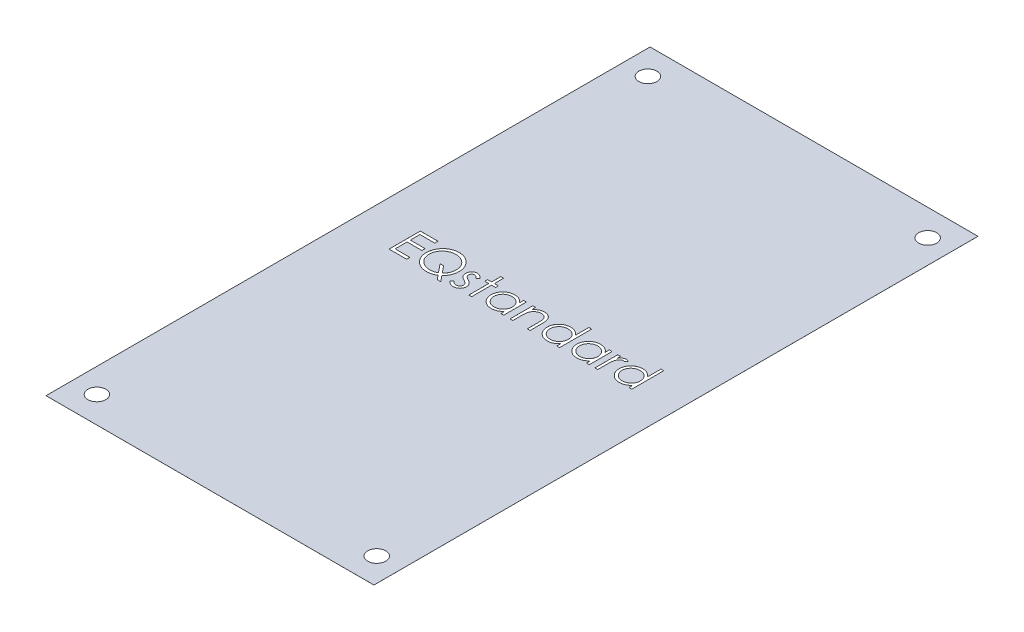
from build123d import *

# Parameters (mm, degrees)
SKETCH2_W           = 66.675
SKETCH2_H           = 122.809
BOSS_EXTRUDE1_DEPTH = 0.00254
SKETCH3_R           = 1.8288
CUT_EXTRUDE1_DEPTH  = 70.870605643
CUT_EXTRUDE2_DEPTH  = 2.54


with BuildPart() as part:
    # Sketch2 → Boss-Extrude1 (new body)
    with BuildSketch(Plane(origin=(0, 0, 0), x_dir=(1, 0, 0), z_dir=(0, 1, 0))):
        Rectangle(SKETCH2_W, SKETCH2_H)
    extrude(amount=BOSS_EXTRUDE1_DEPTH)

    # Sketch3 → Cut-Extrude1 (cut, through all)
    with BuildSketch(Plane(origin=(0, 0.00254, 0), x_dir=(1, 0, 0), z_dir=(0, 1, 0))):
        with Locations((-28.3845, 56.007)):
            Circle(SKETCH3_R)
        with Locations((28.5115, 56.007)):
            Circle(SKETCH3_R)
        with Locations((28.5115, -56.007)):
            Circle(SKETCH3_R)
        with Locations((-28.3845, -56.007)):
            Circle(SKETCH3_R)
    extrude(amount=-CUT_EXTRUDE1_DEPTH, mode=Mode.SUBTRACT)

    # Sketch5 → Cut-Extrude2 (cut)
    # profile 1 of 10: a face of its own
    with BuildSketch(Plane(origin=(0, 0.00254, 0), x_dir=(1, 0, 0), z_dir=(0, 1, 0))):
        Polygon((-24.273262233, 5.635969343), (-20.691210951, 5.635969343), (-20.691210951, 4.984687291), (-23.703390438, 4.984687291), (-23.703390438, 3.030841138), (-20.691210951, 3.030841138), (-20.691210951, 2.379559086), (-23.703390438, 2.379559086), (-23.703390438, -0.062748606), (-20.691210951, -0.062748606), (-20.691210951, -0.714030657), (-24.273262233, -0.714030657), align=None)
    # profile 2 of 10: a face of its own
    with BuildSketch(Plane(origin=(0, 0.00254, 0), x_dir=(1, 0, 0), z_dir=(0, 1, 0))):
        with BuildLine():
            Line((-14.258528659, -0.006779055), (-13.282877618, -1.202492196))
            Line((-13.282877618, -1.202492196), (-13.993945326, -1.202492196))
            Line((-13.993945326, -1.202492196), (-14.698652858, -0.340052292))
            add(Edge.make_bspline(
                [(-14.698652858, -0.340052292), (-14.769332155, -0.383003212), (-14.909388779, -0.468113862), (-15.12776825, -0.577816765), (-15.350490509, -0.669103889), (-15.57706276, -0.744523699), (-15.807154989, -0.804892833), (-16.041933971, -0.846791564), (-16.280548182, -0.871121636), (-16.440862826, -0.874934045), (-16.52147938, -0.87685117)],
                knots=[0, 0, 0, 0, 1.030216282, 2.041455142, 3.041201647, 4.026904037, 5.014869161, 6.002481075, 6.995518502, 8, 8, 8, 8], degree=3))
            add(Edge.make_bspline(
                [(-16.52147938, -0.87685117), (-16.636977427, -0.874069242), (-16.864243202, -0.868595235), (-17.198017557, -0.82080612), (-17.518390695, -0.747000035), (-17.82472404, -0.640209972), (-18.117351293, -0.503807468), (-18.3961365, -0.33564264), (-18.66122136, -0.138044763), (-18.908692816, 0.087694796), (-19.13498036, 0.333267994), (-19.3335335, 0.595651878), (-19.502357315, 0.870492505), (-19.638861426, 1.159160417), (-19.747195681, 1.459142558), (-19.821022539, 1.772933786), (-19.868809804, 2.098666145), (-19.874315014, 2.320450184), (-19.877108387, 2.432984567)],
                knots=[0, 0, 0, 0, 1.055750571, 2.07740284, 3.077223765, 4.05828044, 5.038417088, 6.02463293, 7.030503776, 8.057169806, 9.083586829, 10.080154041, 11.061747002, 12.027853603, 12.995569715, 13.972756451, 14.971366004, 16, 16, 16, 16], degree=3))
            add(Edge.make_bspline(
                [(-19.877108387, 2.432984567), (-19.876114535, 2.50851561), (-19.874133813, 2.659047027), (-19.851220923, 2.881999467), (-19.817178046, 3.101281533), (-19.769025719, 3.315981977), (-19.705990305, 3.526980825), (-19.630417352, 3.733862019), (-19.53885066, 3.93609248), (-19.435336736, 4.133258305), (-19.31988902, 4.323650647), (-19.194129201, 4.504559714), (-19.057747899, 4.674202637), (-18.910841664, 4.832501797), (-18.753997192, 4.979807117), (-18.588563219, 5.118544273), (-18.411012363, 5.243552095), (-18.22603074, 5.359804356), (-18.032580993, 5.462032121), (-17.834446997, 5.553420477), (-17.630146601, 5.627570612), (-17.422330618, 5.69075551), (-17.209738253, 5.738993574), (-16.992535192, 5.772786893), (-16.770874237, 5.79592079), (-16.621181803, 5.797827661), (-16.54564805, 5.798789856)],
                knots=[0, 0, 0, 0, 1.030721839, 2.054201982, 3.056261636, 4.058906239, 5.055198403, 6.060579377, 7.06322398, 8.083343201, 9.098870418, 10.10084648, 11.0888991, 12.067804703, 13.046436456, 14.024708667, 15.012489976, 16.008294399, 17.005242112, 17.997338632, 18.984424362, 19.969624474, 20.960977749, 21.957320355, 22.969278161, 24, 24, 24, 24], degree=3))
            add(Edge.make_bspline(
                [(-16.54564805, 5.798789856), (-16.430149572, 5.796021894), (-16.203303169, 5.79058544), (-15.870355683, 5.742789118), (-15.55092635, 5.668686864), (-15.245242567, 5.56244103), (-14.953576876, 5.425695015), (-14.676051811, 5.257564082), (-14.412237099, 5.059953116), (-14.166058761, 4.83419844), (-13.940304168, 4.588020113), (-13.742692891, 4.324205437), (-13.574563092, 4.046680224), (-13.437812881, 3.755015087), (-13.331582837, 3.449329216), (-13.257325164, 3.129498179), (-13.209757061, 2.796092484), (-13.204260667, 2.568832325), (-13.201467361, 2.453337131)],
                knots=[0, 0, 0, 0, 1.050672203, 2.063587442, 3.054842799, 4.031180399, 5.003107577, 5.981273811, 6.979214548, 7.998088659, 9.016962771, 10.014903508, 10.993069742, 11.96499692, 12.941334519, 13.932589877, 14.949327797, 16, 16, 16, 16], degree=3))
            add(Edge.make_bspline(
                [(-13.201467361, 2.453337131), (-13.204520111, 2.333163624), (-13.210523171, 2.096849226), (-13.261610242, 1.750319338), (-13.343749282, 1.419301664), (-13.460232361, 1.104013087), (-13.610818659, 0.804510916), (-13.792598959, 0.517800098), (-14.007761915, 0.243900962), (-14.174059444, 0.077660947), (-14.258528659, -0.006779055)],
                knots=[0, 0, 0, 0, 1.045660934, 2.056233022, 3.041853582, 4.009978652, 4.97562384, 5.954545411, 6.961031197, 8, 8, 8, 8], degree=3))
        make_face()
        with BuildLine():
            add(Edge.make_bspline(
                [(-14.641411271, 0.462601955), (-14.572126093, 0.532965349), (-14.435839076, 0.671373265), (-14.259009351, 0.898354923), (-14.106918048, 1.134297759), (-13.985152402, 1.382340371), (-13.888271229, 1.639375149), (-13.82133698, 1.907438739), (-13.779426832, 2.185310788), (-13.77405487, 2.374321903), (-13.771339156, 2.46987359)],
                knots=[0, 0, 0, 0, 1.052210109, 2.069743939, 3.061837814, 4.040478349, 5.010453814, 5.985306305, 6.981502329, 8, 8, 8, 8], degree=3))
            add(Edge.make_bspline(
                [(-13.771339156, 2.46987359), (-13.772048731, 2.531407689), (-13.773451437, 2.653049759), (-13.792738608, 2.833058683), (-13.820024219, 3.009091876), (-13.85952542, 3.180834814), (-13.910393262, 3.34793954), (-13.973219515, 3.510179204), (-14.046780108, 3.668077207), (-14.132535687, 3.820652692), (-14.227073957, 3.96768452), (-14.332306649, 4.10737456), (-14.446752554, 4.239002531), (-14.569161401, 4.364737602), (-14.701893234, 4.481987908), (-14.844472024, 4.59070319), (-14.995140879, 4.693514326), (-15.154645372, 4.786314648), (-15.319014704, 4.871630063), (-15.487287087, 4.945507933), (-15.65804959, 5.008079842), (-15.831037779, 5.058817624), (-16.006027805, 5.09875472), (-16.183326461, 5.1260098), (-16.362475253, 5.14527711), (-16.482843076, 5.146763606), (-16.54310398, 5.147507804)],
                knots=[0, 0, 0, 0, 1.032958288, 2.041976502, 3.037103433, 4.023477888, 4.998866292, 5.968231228, 6.943073582, 7.921783703, 8.90545537, 9.876780072, 10.85618943, 11.833110341, 12.821898168, 13.827467856, 14.842673888, 15.88323808, 16.924703457, 17.951432745, 18.967462636, 19.976958182, 20.977218729, 21.979378626, 22.98839684, 24, 24, 24, 24], degree=3))
            add(Edge.make_bspline(
                [(-16.54310398, 5.147507804), (-16.603787776, 5.146758413), (-16.724999492, 5.145261555), (-16.905013186, 5.126116364), (-17.082718743, 5.098724717), (-17.25733458, 5.058986113), (-17.429479073, 5.008149659), (-17.5986179, 4.945199469), (-17.766221979, 4.873146351), (-17.92881337, 4.787885411), (-18.086107595, 4.694287096), (-18.235704357, 4.592498238), (-18.375553538, 4.481503286), (-18.506981741, 4.36308925), (-18.629660702, 4.236342474), (-18.744169652, 4.102106074), (-18.848497612, 3.958822497), (-18.944081648, 3.809055313), (-19.028563354, 3.6526418), (-19.104755133, 3.492404032), (-19.166639782, 3.326575408), (-19.217445767, 3.156483217), (-19.258961946, 2.98255032), (-19.285720735, 2.803767043), (-19.305152581, 2.621249462), (-19.306536573, 2.497912224), (-19.307236592, 2.435528638)],
                knots=[0, 0, 0, 0, 1.013205451, 2.023808328, 3.020541854, 4.015386314, 5.012622987, 6.016502547, 7.02834558, 8.057881235, 9.080621846, 10.084476421, 11.077781791, 12.060654405, 13.037357686, 14.022218736, 15.005346502, 15.995617173, 16.98763393, 17.973029642, 18.956998942, 19.940662314, 20.93709383, 21.940823471, 22.958474994, 24, 24, 24, 24], degree=3))
            add(Edge.make_bspline(
                [(-19.307236592, 2.435528638), (-19.304853425, 2.343811213), (-19.300164998, 2.163374665), (-19.26129911, 1.89846267), (-19.196135569, 1.644850038), (-19.104969069, 1.402173945), (-18.990522034, 1.16903565), (-18.848198491, 0.947719131), (-18.678605634, 0.739067352), (-18.488159233, 0.541647159), (-18.27866535, 0.36279237), (-18.056581515, 0.205380627), (-17.823803828, 0.071830711), (-17.579601327, -0.035959654), (-17.325795039, -0.122518964), (-17.060381424, -0.181121347), (-16.7850955, -0.219964581), (-16.597513944, -0.223683436), (-16.502398852, -0.225569119)],
                knots=[0, 0, 0, 0, 1.022526523, 2.011626, 2.97850031, 3.937665323, 4.897797383, 5.869804095, 6.865337375, 7.89202157, 8.925035373, 9.93268082, 10.923937058, 11.912550332, 12.905497077, 13.90928476, 14.939882052, 16, 16, 16, 16], degree=3))
            add(Edge.make_bspline(
                [(-16.502398852, -0.225569119), (-16.437051176, -0.224857246), (-16.307798088, -0.223449212), (-16.117200107, -0.204252947), (-15.931266255, -0.177233809), (-15.751718327, -0.136140346), (-15.576999362, -0.085052132), (-15.408149342, -0.022907933), (-15.244272583, 0.050764537), (-15.140072586, 0.109048131), (-15.087895646, 0.138232965)],
                knots=[0, 0, 0, 0, 1.060694673, 2.097979151, 3.107774411, 4.11000626, 5.086069662, 6.061987343, 7.029562652, 8, 8, 8, 8], degree=3))
            Line((-15.087895646, 0.138232965), (-16.517663275, 1.891097548))
            Line((-16.517663275, 1.891097548), (-15.806595566, 1.891097548))
            Line((-15.806595566, 1.891097548), (-14.641411271, 0.462601955))
        make_face(mode=Mode.SUBTRACT)
    # profile 3 of 10: a face of its own
    with BuildSketch(Plane(origin=(0, 0.00254, 0), x_dir=(1, 0, 0), z_dir=(0, 1, 0))):
        with BuildLine():
            Line((-9.863646848, 3.347577916), (-10.250345566, 2.949430881))
            add(Edge.make_bspline(
                [(-10.250345566, 2.949430881), (-10.283711194, 2.988099018), (-10.348036197, 3.062646634), (-10.450056169, 3.162318169), (-10.551698993, 3.246023758), (-10.651573269, 3.316694285), (-10.752190414, 3.370123451), (-10.85236968, 3.409121272), (-10.952214791, 3.433254548), (-11.01895517, 3.43636503), (-11.051727778, 3.43789242)],
                knots=[0, 0, 0, 0, 1.26578478, 2.440284043, 3.530471711, 4.527705817, 5.468200915, 6.346673037, 7.188140097, 8, 8, 8, 8], degree=3))
            add(Edge.make_bspline(
                [(-11.051727778, 3.43789242), (-11.091894957, 3.435942293), (-11.17093828, 3.43210472), (-11.28419655, 3.393798925), (-11.389335541, 3.335000213), (-11.480334633, 3.251600069), (-11.557419424, 3.15587061), (-11.613687103, 3.04883442), (-11.648096816, 2.933721541), (-11.652459687, 2.853838799), (-11.654672489, 2.813323109)],
                knots=[0, 0, 0, 0, 0.99966794, 1.967205029, 2.953328237, 3.988086729, 5.028030931, 6.008226631, 6.989793394, 8, 8, 8, 8], degree=3))
            add(Edge.make_bspline(
                [(-11.654672489, 2.813323109), (-11.652657159, 2.776652686), (-11.648632178, 2.703415213), (-11.617341774, 2.595378066), (-11.567510472, 2.490046011), (-11.520937405, 2.425524738), (-11.496940118, 2.392279439)],
                knots=[0, 0, 0, 0, 0.960159726, 1.917612774, 2.927026955, 4, 4, 4, 4], degree=3))
            add(Edge.make_bspline(
                [(-11.496940118, 2.392279439), (-11.482492065, 2.374527407), (-11.451741205, 2.336744445), (-11.39403147, 2.284304597), (-11.328676358, 2.226352228), (-11.250081614, 2.16840968), (-11.161633321, 2.107392122), (-11.061413476, 2.045702538), (-10.952602589, 1.97863851), (-10.874702047, 1.936103605), (-10.834209749, 1.913994182)],
                knots=[0, 0, 0, 0, 0.66740084, 1.420478572, 2.27185888, 3.217733974, 4.268547843, 5.408967954, 6.65319498, 8, 8, 8, 8], degree=3))
            add(Edge.make_bspline(
                [(-10.834209749, 1.913994182), (-10.784836545, 1.886335573), (-10.689463772, 1.832908247), (-10.553949751, 1.749977785), (-10.430964691, 1.667552201), (-10.319466552, 1.586513004), (-10.221600698, 1.504592801), (-10.134397867, 1.424931585), (-10.060033119, 1.345122412), (-10.018388138, 1.289363763), (-9.998482586, 1.262712131)],
                knots=[0, 0, 0, 0, 1.27191281, 2.456916733, 3.569705269, 4.599008579, 5.553216877, 6.436649441, 7.252746552, 8, 8, 8, 8], degree=3))
            add(Edge.make_bspline(
                [(-9.998482586, 1.262712131), (-9.965443486, 1.208889371), (-9.899689545, 1.10177209), (-9.830640976, 0.925390086), (-9.790617335, 0.738318175), (-9.785061592, 0.610352575), (-9.782236592, 0.545284247)],
                knots=[0, 0, 0, 0, 0.995354457, 1.980940102, 2.973342416, 4, 4, 4, 4], degree=3))
            add(Edge.make_bspline(
                [(-9.782236592, 0.545284247), (-9.783542032, 0.499438796), (-9.786114544, 0.409095326), (-9.803999894, 0.276044992), (-9.834761065, 0.148800866), (-9.876659733, 0.025982278), (-9.933237095, -0.090057512), (-9.999545242, -0.202246135), (-10.079146867, -0.308156753), (-10.170026934, -0.407650295), (-10.269532331, -0.498520151), (-10.375679182, -0.578392181), (-10.488598203, -0.644748479), (-10.607482543, -0.699658462), (-10.732602315, -0.743325159), (-10.863977083, -0.773555751), (-11.001189252, -0.791649189), (-11.094497618, -0.794161025), (-11.142042281, -0.795440914)],
                knots=[0, 0, 0, 0, 1.032770009, 2.035186124, 3.017557409, 3.978232242, 4.952395191, 5.920591857, 6.910227898, 7.931268572, 8.952309245, 9.941945286, 10.918353717, 11.897095711, 12.887975737, 13.898235213, 14.929059601, 16, 16, 16, 16], degree=3))
            add(Edge.make_bspline(
                [(-11.142042281, -0.795440914), (-11.206208442, -0.793639872), (-11.333649181, -0.790062813), (-11.522134814, -0.756487531), (-11.706322477, -0.704244459), (-11.884818328, -0.632188407), (-12.053630563, -0.541200685), (-12.208082384, -0.432230342), (-12.348710323, -0.308877061), (-12.428753477, -0.214329352), (-12.468775053, -0.167055497)],
                knots=[0, 0, 0, 0, 1.013940152, 2.01379169, 3.017749504, 4.037548394, 5.051665909, 6.043208538, 7.021604269, 8, 8, 8, 8], degree=3))
            Line((-12.468775053, -0.167055497), (-12.090980582, 0.26289242))
            add(Edge.make_bspline(
                [(-12.090980582, 0.26289242), (-12.055107776, 0.224148775), (-11.985562917, 0.149038363), (-11.874344995, 0.049027059), (-11.761170938, -0.034795247), (-11.647170864, -0.104905442), (-11.530657265, -0.158926531), (-11.412283079, -0.196878837), (-11.292289081, -0.221270443), (-11.211694634, -0.224133898), (-11.171299092, -0.225569119)],
                knots=[0, 0, 0, 0, 1.179806542, 2.287233372, 3.337373186, 4.324005949, 5.273901747, 6.200048787, 7.097828587, 8, 8, 8, 8], degree=3))
            add(Edge.make_bspline(
                [(-11.171299092, -0.225569119), (-11.116293712, -0.223082051), (-11.008822427, -0.218222737), (-10.854891607, -0.174104585), (-10.712762957, -0.104925958), (-10.589349173, -0.006800862), (-10.484298109, 0.107418534), (-10.408228421, 0.236077007), (-10.360555931, 0.37539865), (-10.354957048, 0.471977256), (-10.352108387, 0.521115577)],
                knots=[0, 0, 0, 0, 1.072336372, 2.095165389, 3.102688358, 4.141489647, 5.156069229, 6.117746104, 7.042326257, 8, 8, 8, 8], degree=3))
            add(Edge.make_bspline(
                [(-10.352108387, 0.521115577), (-10.354079235, 0.561591599), (-10.357970411, 0.641506087), (-10.388528919, 0.75716742), (-10.436812237, 0.866875972), (-10.484354956, 0.931082904), (-10.508568723, 0.963783846)],
                knots=[0, 0, 0, 0, 1.013901739, 2.00181326, 2.98231254, 4, 4, 4, 4], degree=3))
            add(Edge.make_bspline(
                [(-10.508568723, 0.963783846), (-10.523123639, 0.980176574), (-10.554829502, 1.015885857), (-10.612986868, 1.067457072), (-10.682622532, 1.123043338), (-10.764519685, 1.181702078), (-10.858843423, 1.242659547), (-10.965976043, 1.305595943), (-11.084449903, 1.373500532), (-11.168216619, 1.418530478), (-11.21200422, 1.442069102)],
                knots=[0, 0, 0, 0, 0.615000592, 1.339693406, 2.178160186, 3.116406724, 4.166410947, 5.330106347, 6.604359322, 8, 8, 8, 8], degree=3))
            add(Edge.make_bspline(
                [(-11.21200422, 1.442069102), (-11.259260267, 1.468447241), (-11.350904823, 1.519602871), (-11.480712051, 1.599279188), (-11.597819394, 1.680318386), (-11.705044722, 1.758174537), (-11.799679689, 1.836952536), (-11.881351481, 1.916739835), (-11.953275601, 1.994318667), (-11.993094477, 2.049286619), (-12.012114396, 2.07554266)],
                knots=[0, 0, 0, 0, 1.262093308, 2.447601706, 3.550203992, 4.582594899, 5.537233252, 6.418365656, 7.244515135, 8, 8, 8, 8], degree=3))
            add(Edge.make_bspline(
                [(-12.012114396, 2.07554266), (-12.045008484, 2.128421133), (-12.110808155, 2.234196558), (-12.174698574, 2.410745566), (-12.218615226, 2.59661017), (-12.22253842, 2.72485632), (-12.224544284, 2.790426474)],
                knots=[0, 0, 0, 0, 0.985009483, 1.970363186, 2.962279964, 4, 4, 4, 4], degree=3))
            add(Edge.make_bspline(
                [(-12.224544284, 2.790426474), (-12.223575101, 2.833289696), (-12.221678273, 2.917179094), (-12.206539779, 3.040439525), (-12.178977675, 3.157548319), (-12.144406601, 3.270264199), (-12.096358864, 3.376403712), (-12.038944151, 3.477382267), (-11.971475537, 3.57306029), (-11.893745566, 3.661965972), (-11.808280653, 3.742718607), (-11.715942999, 3.813110403), (-11.618809305, 3.87317479), (-11.516468315, 3.923548724), (-11.407936886, 3.961651233), (-11.293973642, 3.98788106), (-11.174809261, 4.005398356), (-11.09334579, 4.006964238), (-11.051727778, 4.007764215)],
                knots=[0, 0, 0, 0, 1.087655834, 2.128696564, 3.144119009, 4.137814668, 5.115653402, 6.093965665, 7.082169637, 8.081268856, 9.086088321, 10.061021666, 11.022561449, 11.980240094, 12.950172527, 13.934149372, 14.944599409, 16, 16, 16, 16], degree=3))
            add(Edge.make_bspline(
                [(-11.051727778, 4.007764215), (-11.002393606, 4.005760625), (-10.902799803, 4.001715861), (-10.753384982, 3.969592679), (-10.604190204, 3.916736905), (-10.454832126, 3.843736881), (-10.306404887, 3.749272692), (-10.157602875, 3.635100963), (-10.006639735, 3.501972824), (-9.912376138, 3.400192801), (-9.863646848, 3.347577916)],
                knots=[0, 0, 0, 0, 0.845714091, 1.707292901, 2.609013841, 3.555613372, 4.552488639, 5.621697636, 6.770543573, 8, 8, 8, 8], degree=3))
        make_face()
    # profile 4 of 10: a face of its own
    with BuildSketch(Plane(origin=(0, 0.00254, 0), x_dir=(1, 0, 0), z_dir=(0, 1, 0))):
        Polygon((-8.072621207, 5.798789856), (-7.502749412, 5.798789856), (-7.502749412, 3.926353958), (-6.688646848, 3.926353958), (-6.688646848, 3.356482163), (-7.502749412, 3.356482163), (-7.502749412, -0.714030657), (-8.072621207, -0.714030657), (-8.072621207, 3.356482163), (-8.886723771, 3.356482163), (-8.886723771, 3.926353958), (-8.072621207, 3.926353958), align=None)
    # profile 5 of 10: a face of its own
    with BuildSketch(Plane(origin=(0, 0.00254, 0), x_dir=(1, 0, 0), z_dir=(0, 1, 0))):
        with BuildLine():
            Line((-0.9899289, 3.926353958), (-0.9899289, -0.714030657))
            Line((-0.9899289, -0.714030657), (-1.559800695, -0.714030657))
            Line((-1.559800695, -0.714030657), (-1.559800695, 0.08862359))
            add(Edge.make_bspline(
                [(-1.559800695, 0.08862359), (-1.6240605, 0.015980326), (-1.74946432, -0.125783916), (-1.958907491, -0.310990143), (-2.180918328, -0.464076526), (-2.414419296, -0.587719945), (-2.659199538, -0.680596961), (-2.914716439, -0.74661185), (-3.18107423, -0.789054951), (-3.362960645, -0.793293162), (-3.455133227, -0.795440914)],
                knots=[0, 0, 0, 0, 1.074387032, 2.096679803, 3.090159297, 4.057316773, 5.018401886, 5.985159533, 6.978961417, 8, 8, 8, 8], degree=3))
            add(Edge.make_bspline(
                [(-3.455133227, -0.795440914), (-3.5370808, -0.793215924), (-3.698685043, -0.788828146), (-3.936409226, -0.754787966), (-4.165176593, -0.70012241), (-4.385203317, -0.624102225), (-4.595065638, -0.523262734), (-4.796560385, -0.402537898), (-4.988643698, -0.258772392), (-5.168387776, -0.094419827), (-5.333908691, 0.084096793), (-5.479162714, 0.274497999), (-5.600271873, 0.475960465), (-5.701545448, 0.685933473), (-5.779553102, 0.906033398), (-5.833933838, 1.135499117), (-5.867934363, 1.374059316), (-5.872320327, 1.536509594), (-5.874544284, 1.618882003)],
                knots=[0, 0, 0, 0, 1.033919861, 2.038935746, 3.024066025, 3.998881131, 4.97069526, 5.957263378, 6.95902576, 7.993208707, 9.027059324, 10.027763471, 11.009749337, 11.988697705, 12.965288445, 13.950418724, 14.960734635, 16, 16, 16, 16], degree=3))
            add(Edge.make_bspline(
                [(-5.874544284, 1.618882003), (-5.872271036, 1.699551865), (-5.867776947, 1.859031831), (-5.834297534, 2.093580326), (-5.777998419, 2.319492027), (-5.698990181, 2.536039624), (-5.597676919, 2.743485144), (-5.474435962, 2.941975304), (-5.329258407, 3.132056925), (-5.161886183, 3.309260436), (-4.980575957, 3.472946408), (-4.786612973, 3.615202819), (-4.584822163, 3.73806053), (-4.372073558, 3.835403266), (-4.151516097, 3.914159784), (-3.921186274, 3.968648169), (-3.68204241, 4.000756166), (-3.519681088, 4.005405753), (-3.437324733, 4.007764215)],
                knots=[0, 0, 0, 0, 1.020392517, 2.01726096, 2.990465484, 3.961182959, 4.928053699, 5.906110375, 6.912531644, 7.948652711, 8.985773172, 9.998621852, 10.987621588, 11.969261332, 12.953316658, 13.946091881, 14.958173133, 16, 16, 16, 16], degree=3))
            add(Edge.make_bspline(
                [(-3.437324733, 4.007764215), (-3.342619274, 4.005155722), (-3.15690634, 4.000040593), (-2.885256952, 3.957472502), (-2.628273399, 3.885556997), (-2.383971932, 3.78773525), (-2.15322983, 3.657743985), (-1.938231558, 3.493768913), (-1.736727038, 3.296844188), (-1.619922795, 3.145586381), (-1.559800695, 3.06773016)],
                knots=[0, 0, 0, 0, 1.038897134, 2.037228247, 3.008116434, 3.962042015, 4.918381754, 5.904844433, 6.921570401, 8, 8, 8, 8], degree=3))
            Line((-1.559800695, 3.06773016), (-1.559800695, 3.926353958))
            Line((-1.559800695, 3.926353958), (-0.9899289, 3.926353958))
        make_face()
        with BuildLine():
            add(Edge.make_bspline(
                [(-3.429692521, 3.43789242), (-3.512994249, 3.434928534), (-3.677418609, 3.429078295), (-3.918798441, 3.383406383), (-4.149781349, 3.307415761), (-4.369212084, 3.203490026), (-4.57362442, 3.072809319), (-4.756311509, 2.914746237), (-4.918767552, 2.733613369), (-5.05539826, 2.530228112), (-5.166778162, 2.312190718), (-5.245095491, 2.084272094), (-5.29674684, 1.850583064), (-5.302023727, 1.692082191), (-5.304672489, 1.612521827)],
                knots=[0, 0, 0, 0, 1.031046209, 2.035121221, 3.029706178, 4.034933723, 5.034054252, 6.02443088, 7.017295772, 8.038157696, 9.050218397, 10.03989886, 11.016116709, 12, 12, 12, 12], degree=3))
            add(Edge.make_bspline(
                [(-5.304672489, 1.612521827), (-5.30128904, 1.533436918), (-5.294535404, 1.375577087), (-5.246002001, 1.141569469), (-5.164577088, 0.913597135), (-5.053466488, 0.693595047), (-4.91433504, 0.489335322), (-4.753065628, 0.304749671), (-4.568098689, 0.146018561), (-4.363215926, 0.013144677), (-4.144398608, -0.094193039), (-3.914285618, -0.168879271), (-3.677202675, -0.217098958), (-3.515999155, -0.222731366), (-3.434780662, -0.225569119)],
                knots=[0, 0, 0, 0, 0.979072187, 1.954306742, 2.945804271, 3.96968567, 4.997920485, 5.998718438, 6.996577872, 8.005894225, 9.015743152, 10.005417472, 10.995077863, 12, 12, 12, 12], degree=3))
            add(Edge.make_bspline(
                [(-3.434780662, -0.225569119), (-3.352327722, -0.22255747), (-3.188337, -0.216567599), (-2.946241059, -0.170700161), (-2.711300198, -0.094919627), (-2.486714798, 0.010125932), (-2.277498389, 0.140314278), (-2.089723668, 0.292727143), (-1.930944697, 0.469988634), (-1.796338105, 0.664800199), (-1.690791277, 0.878363392), (-1.613908999, 1.105755424), (-1.568454055, 1.34698421), (-1.562725031, 1.511837335), (-1.559800695, 1.595985368)],
                knots=[0, 0, 0, 0, 1.01762866, 2.023962475, 3.030623092, 4.058876274, 5.077231937, 6.066672613, 7.034107872, 8.005628644, 8.981990164, 9.965428785, 10.961468474, 12, 12, 12, 12], degree=3))
            add(Edge.make_bspline(
                [(-1.559800695, 1.595985368), (-1.561541785, 1.660098289), (-1.564968803, 1.786292807), (-1.591149979, 1.971581303), (-1.632796774, 2.148898206), (-1.691481969, 2.318429942), (-1.768573299, 2.479239184), (-1.861551388, 2.632480578), (-1.972051276, 2.777357118), (-2.098294167, 2.911873833), (-2.236479606, 3.034567557), (-2.38270113, 3.144085537), (-2.538691142, 3.234053739), (-2.701826338, 3.308514331), (-2.872389759, 3.367767361), (-3.051769312, 3.407296462), (-3.238058331, 3.434438759), (-3.365141889, 3.436729078), (-3.429692521, 3.43789242)],
                knots=[0, 0, 0, 0, 1.050140795, 2.067009409, 3.05949893, 4.030605086, 5.00011959, 5.97591094, 6.962425594, 7.979863591, 8.993523472, 9.986985069, 10.967611495, 11.937549037, 12.921786183, 13.919465291, 14.943216303, 16, 16, 16, 16], degree=3))
        make_face(mode=Mode.SUBTRACT)
    # profile 6 of 10: a face of its own
    with BuildSketch(Plane(origin=(0, 0.00254, 0), x_dir=(1, 0, 0), z_dir=(0, 1, 0))):
        with BuildLine():
            Line((0.312635203, 3.926353958), (0.882506998, 3.926353958))
            Line((0.882506998, 3.926353958), (0.882506998, 3.089354759))
            add(Edge.make_bspline(
                [(0.882506998, 3.089354759), (0.94335385, 3.165269414), (1.06142929, 3.312584449), (1.258069437, 3.506206063), (1.465884799, 3.665763828), (1.68360272, 3.79295214), (1.911518753, 3.888831019), (2.148243614, 3.958074922), (2.395194581, 3.99959454), (2.563132916, 4.005019672), (2.648091934, 4.007764215)],
                knots=[0, 0, 0, 0, 1.12780773, 2.188550248, 3.19190651, 4.159438251, 5.104880172, 6.052711206, 7.014878035, 8, 8, 8, 8], degree=3))
            add(Edge.make_bspline(
                [(2.648091934, 4.007764215), (2.733963227, 4.004597931), (2.902034061, 3.998400751), (3.146741401, 3.949384755), (3.37529313, 3.865664078), (3.586874324, 3.750979321), (3.777605125, 3.60836472), (3.945108784, 3.442216458), (4.083653533, 3.251106707), (4.176540178, 3.073808981), (4.237728138, 2.91653074), (4.276249665, 2.781825922), (4.308963017, 2.631751562), (4.337323474, 2.466761165), (4.356513377, 2.285698734), (4.371648677, 2.089306493), (4.382495737, 1.877648056), (4.382926098, 1.73125946), (4.383148023, 1.655771025)],
                knots=[0, 0, 0, 0, 1.235846778, 2.418850247, 3.575807741, 4.728682307, 5.871620074, 6.994088408, 8.11269785, 9.256955736, 9.865816715, 10.540099792, 11.271859618, 12.076849838, 12.949306005, 13.892391288, 14.913166135, 16, 16, 16, 16], degree=3))
            Line((4.383148023, 1.655771025), (4.383148023, -0.714030657))
            Line((4.383148023, -0.714030657), (3.813276229, -0.714030657))
            Line((3.813276229, -0.714030657), (3.813276229, 1.468781843))
            add(Edge.make_bspline(
                [(3.813276229, 1.468781843), (3.812925694, 1.531959707), (3.812255181, 1.65280821), (3.810140365, 1.825834866), (3.805042573, 1.98274623), (3.797879205, 2.123167168), (3.787394393, 2.246962842), (3.776467619, 2.354385387), (3.763105447, 2.445298414), (3.751198447, 2.500026492), (3.74585836, 2.524571106)],
                knots=[0, 0, 0, 0, 1.430800155, 2.736877192, 3.918605307, 4.986035426, 5.920637409, 6.731861385, 7.431261377, 8, 8, 8, 8], degree=3))
            add(Edge.make_bspline(
                [(3.74585836, 2.524571106), (3.72658061, 2.596618541), (3.689476906, 2.735287563), (3.597793822, 2.92338246), (3.482016665, 3.083399173), (3.34068771, 3.214348368), (3.175172101, 3.316258314), (2.985929142, 3.386968203), (2.774785037, 3.43119372), (2.6262778, 3.435597231), (2.548873184, 3.43789242)],
                knots=[0, 0, 0, 0, 1.084156227, 2.086665306, 3.027808233, 3.945421172, 4.874247719, 5.839848303, 6.874090471, 8, 8, 8, 8], degree=3))
            add(Edge.make_bspline(
                [(2.548873184, 3.43789242), (2.503030386, 3.437028811), (2.412308675, 3.435319752), (2.27777944, 3.418172397), (2.14728844, 3.390126342), (2.019526061, 3.352264671), (1.897047635, 3.300263126), (1.775918135, 3.241245554), (1.66069872, 3.167679512), (1.548932557, 3.085690813), (1.444950749, 2.994832823), (1.348197906, 2.898957783), (1.261950355, 2.796857759), (1.183811473, 2.690177855), (1.116359481, 2.577452948), (1.057480307, 2.459770564), (1.007522689, 2.336975808), (0.982698376, 2.251749626), (0.97027743, 2.209106362)],
                knots=[0, 0, 0, 0, 1.023777757, 2.026029729, 3.023749952, 4.003683103, 4.997618607, 5.993177895, 7.010360494, 8.046726602, 9.087585522, 10.09234134, 11.086953743, 12.070360549, 13.043493632, 14.017870808, 15.008233677, 16, 16, 16, 16], degree=3))
            add(Edge.make_bspline(
                [(0.97027743, 2.209106362), (0.963129782, 2.177800494), (0.947569726, 2.109649256), (0.930763671, 1.997808666), (0.915509927, 1.868431997), (0.902742874, 1.721670222), (0.894931618, 1.557009506), (0.886414641, 1.375153057), (0.883313916, 1.175375728), (0.882783503, 1.036289514), (0.882506998, 0.963783846)],
                knots=[0, 0, 0, 0, 0.615963638, 1.340920617, 2.168419149, 3.115676021, 4.16674242, 5.331190069, 6.6087489, 8, 8, 8, 8], degree=3))
            Line((0.882506998, 0.963783846), (0.882506998, -0.714030657))
            Line((0.882506998, -0.714030657), (0.312635203, -0.714030657))
            Line((0.312635203, -0.714030657), (0.312635203, 3.926353958))
        make_face()
    # profile 7 of 10: a face of its own
    with BuildSketch(Plane(origin=(0, 0.00254, 0), x_dir=(1, 0, 0), z_dir=(0, 1, 0))):
        with BuildLine():
            Line((10.407506998, 5.798789856), (10.407506998, -0.714030657))
            Line((10.407506998, -0.714030657), (9.837635203, -0.714030657))
            Line((9.837635203, -0.714030657), (9.837635203, 0.08862359))
            add(Edge.make_bspline(
                [(9.837635203, 0.08862359), (9.773375397, 0.015980326), (9.647971578, -0.125783916), (9.438528407, -0.310990143), (9.21651757, -0.464076526), (8.983016601, -0.587719945), (8.73823636, -0.680596961), (8.482719459, -0.74661185), (8.216361668, -0.789054951), (8.034475253, -0.793293162), (7.942302671, -0.795440914)],
                knots=[0, 0, 0, 0, 1.074387032, 2.096679803, 3.090159297, 4.057316773, 5.018401886, 5.985159533, 6.978961417, 8, 8, 8, 8], degree=3))
            add(Edge.make_bspline(
                [(7.942302671, -0.795440914), (7.860355097, -0.793215924), (7.698750854, -0.788828146), (7.461026672, -0.754787966), (7.232259305, -0.70012241), (7.01223258, -0.624102225), (6.802370259, -0.523262734), (6.600875512, -0.402537898), (6.408792199, -0.258772392), (6.229048122, -0.094419827), (6.063527207, 0.084096793), (5.918273183, 0.274497999), (5.797164024, 0.475960465), (5.695890449, 0.685933473), (5.617882796, 0.906033398), (5.563502059, 1.135499117), (5.529501535, 1.374059316), (5.52511557, 1.536509594), (5.522891613, 1.618882003)],
                knots=[0, 0, 0, 0, 1.033919861, 2.038935746, 3.024066025, 3.998881131, 4.97069526, 5.957263378, 6.95902576, 7.993208707, 9.027059324, 10.027763471, 11.009749337, 11.988697705, 12.965288445, 13.950418724, 14.960734635, 16, 16, 16, 16], degree=3))
            add(Edge.make_bspline(
                [(5.522891613, 1.618882003), (5.525164861, 1.699551865), (5.52965895, 1.859031831), (5.563138363, 2.093580326), (5.619437479, 2.319492027), (5.698445717, 2.536039624), (5.799758978, 2.743485144), (5.922999936, 2.941975304), (6.068177491, 3.132056925), (6.235549715, 3.309260436), (6.416859941, 3.472946408), (6.610822924, 3.615202819), (6.812613734, 3.73806053), (7.025362339, 3.835403266), (7.245919801, 3.914159784), (7.476249624, 3.968648169), (7.715393488, 4.000756166), (7.877754809, 4.005405753), (7.960111164, 4.007764215)],
                knots=[0, 0, 0, 0, 1.020392517, 2.01726096, 2.990465484, 3.961182959, 4.928053699, 5.906110375, 6.912531644, 7.948652711, 8.985773172, 9.998621852, 10.987621588, 11.969261332, 12.953316658, 13.946091881, 14.958173133, 16, 16, 16, 16], degree=3))
            add(Edge.make_bspline(
                [(7.960111164, 4.007764215), (8.054847373, 4.004921055), (8.240804022, 3.999340248), (8.512762768, 3.952701553), (8.770006004, 3.874391761), (9.01401471, 3.767183293), (9.243334183, 3.627844787), (9.459645374, 3.45956716), (9.659186546, 3.25758791), (9.777245424, 3.105892626), (9.837635203, 3.028297067)],
                knots=[0, 0, 0, 0, 1.031072012, 2.023879775, 2.993683497, 3.952812103, 4.918022106, 5.908088563, 6.929940113, 8, 8, 8, 8], degree=3))
            Line((9.837635203, 3.028297067), (9.837635203, 5.798789856))
            Line((9.837635203, 5.798789856), (10.407506998, 5.798789856))
        make_face()
        with BuildLine():
            add(Edge.make_bspline(
                [(7.967743376, 3.43789242), (7.884441649, 3.434928534), (7.720017289, 3.429078295), (7.478637456, 3.383406383), (7.247654548, 3.307415761), (7.028223813, 3.203490026), (6.823811477, 3.072809319), (6.641124389, 2.914746237), (6.478668345, 2.733613369), (6.342037637, 2.530228112), (6.230657736, 2.312190718), (6.152340406, 2.084272094), (6.100689057, 1.850583064), (6.09541217, 1.692082191), (6.092763408, 1.612521827)],
                knots=[0, 0, 0, 0, 1.031046209, 2.035121221, 3.029706178, 4.034933723, 5.034054252, 6.02443088, 7.017295772, 8.038157696, 9.050218397, 10.03989886, 11.016116709, 12, 12, 12, 12], degree=3))
            add(Edge.make_bspline(
                [(6.092763408, 1.612521827), (6.096146857, 1.533436918), (6.102900494, 1.375577087), (6.151433897, 1.141569469), (6.23285881, 0.913597135), (6.343969409, 0.693595047), (6.483100857, 0.489335322), (6.64437027, 0.304749671), (6.829337209, 0.146018561), (7.034219971, 0.013144677), (7.253037289, -0.094193039), (7.483150279, -0.168879271), (7.720233223, -0.217098958), (7.881436743, -0.222731366), (7.962655235, -0.225569119)],
                knots=[0, 0, 0, 0, 0.979072187, 1.954306742, 2.945804271, 3.96968567, 4.997920485, 5.998718438, 6.996577872, 8.005894225, 9.015743152, 10.005417472, 10.995077863, 12, 12, 12, 12], degree=3))
            add(Edge.make_bspline(
                [(7.962655235, -0.225569119), (8.045108176, -0.22255747), (8.209098897, -0.216567599), (8.451194838, -0.170700161), (8.686135699, -0.094919627), (8.9107211, 0.010125932), (9.119937509, 0.140314278), (9.30771223, 0.292727143), (9.466491201, 0.469988634), (9.601097793, 0.664800199), (9.70664462, 0.878363392), (9.783526899, 1.105755424), (9.828981842, 1.34698421), (9.834710866, 1.511837335), (9.837635203, 1.595985368)],
                knots=[0, 0, 0, 0, 1.01762866, 2.023962475, 3.030623092, 4.058876274, 5.077231937, 6.066672613, 7.034107872, 8.005628644, 8.981990164, 9.965428785, 10.961468474, 12, 12, 12, 12], degree=3))
            add(Edge.make_bspline(
                [(9.837635203, 1.595985368), (9.835894112, 1.660098289), (9.832467094, 1.786292807), (9.806285918, 1.971581303), (9.764639123, 2.148898206), (9.705953929, 2.318429942), (9.628862599, 2.479239184), (9.535884509, 2.632480578), (9.425384622, 2.777357118), (9.29914173, 2.911873833), (9.160956291, 3.034567557), (9.014734768, 3.144085537), (8.858744755, 3.234053739), (8.69560956, 3.308514331), (8.525046139, 3.367767361), (8.345666586, 3.407296462), (8.159377566, 3.434438759), (8.032294009, 3.436729078), (7.967743376, 3.43789242)],
                knots=[0, 0, 0, 0, 1.050140795, 2.067009409, 3.05949893, 4.030605086, 5.00011959, 5.97591094, 6.962425594, 7.979863591, 8.993523472, 9.986985069, 10.967611495, 11.937549037, 12.921786183, 13.919465291, 14.943216303, 16, 16, 16, 16], degree=3))
        make_face(mode=Mode.SUBTRACT)
    # profile 8 of 10: a face of its own
    with BuildSketch(Plane(origin=(0, 0.00254, 0), x_dir=(1, 0, 0), z_dir=(0, 1, 0))):
        with BuildLine():
            Line((16.431865972, 3.926353958), (16.431865972, -0.714030657))
            Line((16.431865972, -0.714030657), (15.861994177, -0.714030657))
            Line((15.861994177, -0.714030657), (15.861994177, 0.08862359))
            add(Edge.make_bspline(
                [(15.861994177, 0.08862359), (15.797734371, 0.015980326), (15.672330552, -0.125783916), (15.462887381, -0.310990143), (15.240876544, -0.464076526), (15.007375576, -0.587719945), (14.762595334, -0.680596961), (14.507078433, -0.74661185), (14.240720642, -0.789054951), (14.058834227, -0.793293162), (13.966661645, -0.795440914)],
                knots=[0, 0, 0, 0, 1.074387032, 2.096679803, 3.090159297, 4.057316773, 5.018401886, 5.985159533, 6.978961417, 8, 8, 8, 8], degree=3))
            add(Edge.make_bspline(
                [(13.966661645, -0.795440914), (13.884714072, -0.793215924), (13.723109829, -0.788828146), (13.485385646, -0.754787966), (13.256618279, -0.70012241), (13.036591554, -0.624102225), (12.826729233, -0.523262734), (12.625234487, -0.402537898), (12.433151174, -0.258772392), (12.253407096, -0.094419827), (12.087886181, 0.084096793), (11.942632158, 0.274497999), (11.821522999, 0.475960465), (11.720249424, 0.685933473), (11.64224177, 0.906033398), (11.587861034, 1.135499117), (11.553860509, 1.374059316), (11.549474545, 1.536509594), (11.547250588, 1.618882003)],
                knots=[0, 0, 0, 0, 1.033919861, 2.038935746, 3.024066025, 3.998881131, 4.97069526, 5.957263378, 6.95902576, 7.993208707, 9.027059324, 10.027763471, 11.009749337, 11.988697705, 12.965288445, 13.950418724, 14.960734635, 16, 16, 16, 16], degree=3))
            add(Edge.make_bspline(
                [(11.547250588, 1.618882003), (11.549523836, 1.699551865), (11.554017924, 1.859031831), (11.587497338, 2.093580326), (11.643796453, 2.319492027), (11.722804691, 2.536039624), (11.824117952, 2.743485144), (11.94735891, 2.941975304), (12.092536465, 3.132056925), (12.259908689, 3.309260436), (12.441218915, 3.472946408), (12.635181898, 3.615202819), (12.836972709, 3.73806053), (13.049721313, 3.835403266), (13.270278775, 3.914159784), (13.500608598, 3.968648169), (13.739752462, 4.000756166), (13.902113784, 4.005405753), (13.984470139, 4.007764215)],
                knots=[0, 0, 0, 0, 1.020392517, 2.01726096, 2.990465484, 3.961182959, 4.928053699, 5.906110375, 6.912531644, 7.948652711, 8.985773172, 9.998621852, 10.987621588, 11.969261332, 12.953316658, 13.946091881, 14.958173133, 16, 16, 16, 16], degree=3))
            add(Edge.make_bspline(
                [(13.984470139, 4.007764215), (14.079175597, 4.005155722), (14.264888532, 4.000040593), (14.53653792, 3.957472502), (14.793521473, 3.885556997), (15.03782294, 3.78773525), (15.268565042, 3.657743985), (15.483563314, 3.493768913), (15.685067833, 3.296844188), (15.801872077, 3.145586381), (15.861994177, 3.06773016)],
                knots=[0, 0, 0, 0, 1.038897134, 2.037228247, 3.008116434, 3.962042015, 4.918381754, 5.904844433, 6.921570401, 8, 8, 8, 8], degree=3))
            Line((15.861994177, 3.06773016), (15.861994177, 3.926353958))
            Line((15.861994177, 3.926353958), (16.431865972, 3.926353958))
        make_face()
        with BuildLine():
            add(Edge.make_bspline(
                [(13.99210235, 3.43789242), (13.908800623, 3.434928534), (13.744376263, 3.429078295), (13.502996431, 3.383406383), (13.272013522, 3.307415761), (13.052582788, 3.203490026), (12.848170452, 3.072809319), (12.665483363, 2.914746237), (12.503027319, 2.733613369), (12.366396611, 2.530228112), (12.25501671, 2.312190718), (12.17669938, 2.084272094), (12.125048032, 1.850583064), (12.119771144, 1.692082191), (12.117122382, 1.612521827)],
                knots=[0, 0, 0, 0, 1.031046209, 2.035121221, 3.029706178, 4.034933723, 5.034054252, 6.02443088, 7.017295772, 8.038157696, 9.050218397, 10.03989886, 11.016116709, 12, 12, 12, 12], degree=3))
            add(Edge.make_bspline(
                [(12.117122382, 1.612521827), (12.120505832, 1.533436918), (12.127259468, 1.375577087), (12.175792871, 1.141569469), (12.257217784, 0.913597135), (12.368328384, 0.693595047), (12.507459831, 0.489335322), (12.668729244, 0.304749671), (12.853696183, 0.146018561), (13.058578946, 0.013144677), (13.277396263, -0.094193039), (13.507509253, -0.168879271), (13.744592197, -0.217098958), (13.905795717, -0.222731366), (13.987014209, -0.225569119)],
                knots=[0, 0, 0, 0, 0.979072187, 1.954306742, 2.945804271, 3.96968567, 4.997920485, 5.998718438, 6.996577872, 8.005894225, 9.015743152, 10.005417472, 10.995077863, 12, 12, 12, 12], degree=3))
            add(Edge.make_bspline(
                [(13.987014209, -0.225569119), (14.06946715, -0.22255747), (14.233457871, -0.216567599), (14.475553813, -0.170700161), (14.710494674, -0.094919627), (14.935080074, 0.010125932), (15.144296483, 0.140314278), (15.332071204, 0.292727143), (15.490850175, 0.469988634), (15.625456767, 0.664800199), (15.731003594, 0.878363392), (15.807885873, 1.105755424), (15.853340817, 1.34698421), (15.85906984, 1.511837335), (15.861994177, 1.595985368)],
                knots=[0, 0, 0, 0, 1.01762866, 2.023962475, 3.030623092, 4.058876274, 5.077231937, 6.066672613, 7.034107872, 8.005628644, 8.981990164, 9.965428785, 10.961468474, 12, 12, 12, 12], degree=3))
            add(Edge.make_bspline(
                [(15.861994177, 1.595985368), (15.860253086, 1.660098289), (15.856826069, 1.786292807), (15.830644893, 1.971581303), (15.788998097, 2.148898206), (15.730312903, 2.318429942), (15.653221573, 2.479239184), (15.560243483, 2.632480578), (15.449743596, 2.777357118), (15.323500705, 2.911873833), (15.185315266, 3.034567557), (15.039093742, 3.144085537), (14.88310373, 3.234053739), (14.719968534, 3.308514331), (14.549405113, 3.367767361), (14.37002556, 3.407296462), (14.183736541, 3.434438759), (14.056652983, 3.436729078), (13.99210235, 3.43789242)],
                knots=[0, 0, 0, 0, 1.050140795, 2.067009409, 3.05949893, 4.030605086, 5.00011959, 5.97591094, 6.962425594, 7.979863591, 8.993523472, 9.986985069, 10.967611495, 11.937549037, 12.921786183, 13.919465291, 14.943216303, 16, 16, 16, 16], degree=3))
        make_face(mode=Mode.SUBTRACT)
    # profile 9 of 10: a face of its own
    with BuildSketch(Plane(origin=(0, 0.00254, 0), x_dir=(1, 0, 0), z_dir=(0, 1, 0))):
        with BuildLine():
            Line((17.571609562, 3.926353958), (18.141481357, 3.926353958))
            Line((18.141481357, 3.926353958), (18.141481357, 3.243271025))
            add(Edge.make_bspline(
                [(18.141481357, 3.243271025), (18.18355239, 3.306872314), (18.264012916, 3.428509284), (18.39774923, 3.58938073), (18.534733846, 3.7225766), (18.675622543, 3.828718699), (18.821451381, 3.908208214), (18.969019851, 3.966434149), (19.120649632, 4.000864421), (19.222543408, 4.005461203), (19.273592735, 4.007764215)],
                knots=[0, 0, 0, 0, 1.2804753, 2.448899062, 3.506932113, 4.484331642, 5.4025378, 6.288909075, 7.142734305, 8, 8, 8, 8], degree=3))
            add(Edge.make_bspline(
                [(19.273592735, 4.007764215), (19.313191927, 4.005604259), (19.394669839, 4.001160011), (19.518009681, 3.969934657), (19.645088515, 3.920081673), (19.726989703, 3.873200127), (19.769686485, 3.848759807)],
                knots=[0, 0, 0, 0, 0.901110191, 1.854092781, 2.881294221, 4, 4, 4, 4], degree=3))
            Line((19.769686485, 3.848759807), (19.456765812, 3.355210128))
            add(Edge.make_bspline(
                [(19.456765812, 3.355210128), (19.429353731, 3.367438897), (19.377320353, 3.39065144), (19.301202783, 3.418123373), (19.231023786, 3.434299392), (19.18631333, 3.436749979), (19.165469738, 3.43789242)],
                knots=[0, 0, 0, 0, 1.180555205, 2.24091978, 3.179933427, 4, 4, 4, 4], degree=3))
            add(Edge.make_bspline(
                [(19.165469738, 3.43789242), (19.119739336, 3.434844352), (19.026462571, 3.428627177), (18.889512122, 3.379752483), (18.756620764, 3.300785262), (18.651080748, 3.213207673), (18.569361232, 3.128756669), (18.51104968, 3.055008853), (18.457559553, 2.972316193), (18.406450725, 2.882092338), (18.359884734, 2.78279676), (18.31642412, 2.675421502), (18.277128754, 2.559842197), (18.254721883, 2.479319624), (18.243244177, 2.438072708)],
                knots=[0, 0, 0, 0, 1.125678352, 2.296057538, 3.5422874, 4.923748041, 5.663163013, 6.437101912, 7.23742474, 8.08941207, 8.991984279, 9.93940061, 10.944477711, 12, 12, 12, 12], degree=3))
            add(Edge.make_bspline(
                [(18.243244177, 2.438072708), (18.234658264, 2.401284122), (18.215641117, 2.319800199), (18.197150756, 2.183096447), (18.178881773, 2.021582094), (18.16600648, 1.834807561), (18.154072032, 1.62323927), (18.147340883, 1.386554912), (18.141710899, 1.124511546), (18.141560192, 0.94131522), (18.141481357, 0.845484567)],
                knots=[0, 0, 0, 0, 0.566838948, 1.255505196, 2.06880316, 3.007127437, 4.065329342, 5.249902469, 6.561414163, 8, 8, 8, 8], degree=3))
            Line((18.141481357, 0.845484567), (18.141481357, -0.714030657))
            Line((18.141481357, -0.714030657), (17.571609562, -0.714030657))
            Line((17.571609562, -0.714030657), (17.571609562, 3.926353958))
        make_face()
    # profile 10 of 10: a face of its own
    with BuildSketch(Plane(origin=(0, 0.00254, 0), x_dir=(1, 0, 0), z_dir=(0, 1, 0))):
        with BuildLine():
            Line((25.061353152, 5.798789856), (25.061353152, -0.714030657))
            Line((25.061353152, -0.714030657), (24.491481357, -0.714030657))
            Line((24.491481357, -0.714030657), (24.491481357, 0.08862359))
            add(Edge.make_bspline(
                [(24.491481357, 0.08862359), (24.427221551, 0.015980326), (24.301817732, -0.125783916), (24.092374561, -0.310990143), (23.870363724, -0.464076526), (23.636862755, -0.587719945), (23.392082514, -0.680596961), (23.136565612, -0.74661185), (22.870207821, -0.789054951), (22.688321406, -0.793293162), (22.596148825, -0.795440914)],
                knots=[0, 0, 0, 0, 1.074387032, 2.096679803, 3.090159297, 4.057316773, 5.018401886, 5.985159533, 6.978961417, 8, 8, 8, 8], degree=3))
            add(Edge.make_bspline(
                [(22.596148825, -0.795440914), (22.514201251, -0.793215924), (22.352597008, -0.788828146), (22.114872825, -0.754787966), (21.886105459, -0.70012241), (21.666078734, -0.624102225), (21.456216413, -0.523262734), (21.254721666, -0.402537898), (21.062638353, -0.258772392), (20.882894275, -0.094419827), (20.717373361, 0.084096793), (20.572119337, 0.274497999), (20.451010178, 0.475960465), (20.349736603, 0.685933473), (20.27172895, 0.906033398), (20.217348213, 1.135499117), (20.183347689, 1.374059316), (20.178961724, 1.536509594), (20.176737767, 1.618882003)],
                knots=[0, 0, 0, 0, 1.033919861, 2.038935746, 3.024066025, 3.998881131, 4.97069526, 5.957263378, 6.95902576, 7.993208707, 9.027059324, 10.027763471, 11.009749337, 11.988697705, 12.965288445, 13.950418724, 14.960734635, 16, 16, 16, 16], degree=3))
            add(Edge.make_bspline(
                [(20.176737767, 1.618882003), (20.179011015, 1.699551865), (20.183505104, 1.859031831), (20.216984517, 2.093580326), (20.273283633, 2.319492027), (20.352291871, 2.536039624), (20.453605132, 2.743485144), (20.57684609, 2.941975304), (20.722023645, 3.132056925), (20.889395869, 3.309260436), (21.070706095, 3.472946408), (21.264669078, 3.615202819), (21.466459888, 3.73806053), (21.679208493, 3.835403266), (21.899765955, 3.914159784), (22.130095778, 3.968648169), (22.369239642, 4.000756166), (22.531600963, 4.005405753), (22.613957318, 4.007764215)],
                knots=[0, 0, 0, 0, 1.020392517, 2.01726096, 2.990465484, 3.961182959, 4.928053699, 5.906110375, 6.912531644, 7.948652711, 8.985773172, 9.998621852, 10.987621588, 11.969261332, 12.953316658, 13.946091881, 14.958173133, 16, 16, 16, 16], degree=3))
            add(Edge.make_bspline(
                [(22.613957318, 4.007764215), (22.708693527, 4.004921055), (22.894650175, 3.999340248), (23.166608922, 3.952701553), (23.423852158, 3.874391761), (23.667860864, 3.767183293), (23.897180337, 3.627844787), (24.113491528, 3.45956716), (24.3130327, 3.25758791), (24.431091578, 3.105892626), (24.491481357, 3.028297067)],
                knots=[0, 0, 0, 0, 1.031072012, 2.023879775, 2.993683497, 3.952812103, 4.918022106, 5.908088563, 6.929940113, 8, 8, 8, 8], degree=3))
            Line((24.491481357, 3.028297067), (24.491481357, 5.798789856))
            Line((24.491481357, 5.798789856), (25.061353152, 5.798789856))
        make_face()
        with BuildLine():
            add(Edge.make_bspline(
                [(22.62158953, 3.43789242), (22.538287803, 3.434928534), (22.373863443, 3.429078295), (22.13248361, 3.383406383), (21.901500702, 3.307415761), (21.682069967, 3.203490026), (21.477657631, 3.072809319), (21.294970543, 2.914746237), (21.132514499, 2.733613369), (20.995883791, 2.530228112), (20.884503889, 2.312190718), (20.80618656, 2.084272094), (20.754535211, 1.850583064), (20.749258324, 1.692082191), (20.746609562, 1.612521827)],
                knots=[0, 0, 0, 0, 1.031046209, 2.035121221, 3.029706178, 4.034933723, 5.034054252, 6.02443088, 7.017295772, 8.038157696, 9.050218397, 10.03989886, 11.016116709, 12, 12, 12, 12], degree=3))
            add(Edge.make_bspline(
                [(20.746609562, 1.612521827), (20.749993011, 1.533436918), (20.756746648, 1.375577087), (20.80528005, 1.141569469), (20.886704964, 0.913597135), (20.997815563, 0.693595047), (21.136947011, 0.489335322), (21.298216423, 0.304749671), (21.483183362, 0.146018561), (21.688066125, 0.013144677), (21.906883443, -0.094193039), (22.136996433, -0.168879271), (22.374079376, -0.217098958), (22.535282896, -0.222731366), (22.616501389, -0.225569119)],
                knots=[0, 0, 0, 0, 0.979072187, 1.954306742, 2.945804271, 3.96968567, 4.997920485, 5.998718438, 6.996577872, 8.005894225, 9.015743152, 10.005417472, 10.995077863, 12, 12, 12, 12], degree=3))
            add(Edge.make_bspline(
                [(22.616501389, -0.225569119), (22.69895433, -0.22255747), (22.862945051, -0.216567599), (23.105040992, -0.170700161), (23.339981853, -0.094919627), (23.564567253, 0.010125932), (23.773783663, 0.140314278), (23.961558384, 0.292727143), (24.120337355, 0.469988634), (24.254943946, 0.664800199), (24.360490774, 0.878363392), (24.437373053, 1.105755424), (24.482827996, 1.34698421), (24.48855702, 1.511837335), (24.491481357, 1.595985368)],
                knots=[0, 0, 0, 0, 1.01762866, 2.023962475, 3.030623092, 4.058876274, 5.077231937, 6.066672613, 7.034107872, 8.005628644, 8.981990164, 9.965428785, 10.961468474, 12, 12, 12, 12], degree=3))
            add(Edge.make_bspline(
                [(24.491481357, 1.595985368), (24.489740266, 1.660098289), (24.486313248, 1.786292807), (24.460132072, 1.971581303), (24.418485277, 2.148898206), (24.359800083, 2.318429942), (24.282708752, 2.479239184), (24.189730663, 2.632480578), (24.079230776, 2.777357118), (23.952987884, 2.911873833), (23.814802445, 3.034567557), (23.668580921, 3.144085537), (23.512590909, 3.234053739), (23.349455714, 3.308514331), (23.178892292, 3.367767361), (22.999512739, 3.407296462), (22.81322372, 3.434438759), (22.686140163, 3.436729078), (22.62158953, 3.43789242)],
                knots=[0, 0, 0, 0, 1.050140795, 2.067009409, 3.05949893, 4.030605086, 5.00011959, 5.97591094, 6.962425594, 7.979863591, 8.993523472, 9.986985069, 10.967611495, 11.937549037, 12.921786183, 13.919465291, 14.943216303, 16, 16, 16, 16], degree=3))
        make_face(mode=Mode.SUBTRACT)
    extrude(amount=-CUT_EXTRUDE2_DEPTH, mode=Mode.SUBTRACT)


with BuildPart() as cut_extrude2_piece_1:
    # of the separate pieces the step leaves, piece 1, a body of its own (cut_extrude2_pieces)
    add(part.part.solids().sort_by_distance((-33.3375, 0, 61.4045))[0])


with BuildPart() as cut_extrude2_piece_2:
    # of the separate pieces the step leaves, piece 2, a body of its own (cut_extrude2_pieces)
    add(part.part.solids().sort_by_distance((-13.771339156, 0, -2.46987359))[0])


with BuildPart() as cut_extrude2_piece_3:
    # of the separate pieces the step leaves, piece 3, a body of its own (cut_extrude2_pieces)
    add(part.part.solids().sort_by_distance((6.092763408, 0, -1.612521827))[0])


with BuildPart() as cut_extrude2_piece_4:
    # of the separate pieces the step leaves, piece 4, a body of its own (cut_extrude2_pieces)
    add(part.part.solids().sort_by_distance((20.746609562, 0, -1.612521827))[0])


with BuildPart() as cut_extrude2_piece_5:
    # of the separate pieces the step leaves, piece 5, a body of its own (cut_extrude2_pieces)
    add(part.part.solids().sort_by_distance((12.117122382, 0, -1.612521827))[0])


with BuildPart() as cut_extrude2_piece_6:
    # of the separate pieces the step leaves, piece 6, a body of its own (cut_extrude2_pieces)
    add(part.part.solids().sort_by_distance((-5.304672489, 0, -1.612521827))[0])


solid = Compound([cut_extrude2_piece_1.part, cut_extrude2_piece_2.part, cut_extrude2_piece_3.part, cut_extrude2_piece_4.part, cut_extrude2_piece_5.part, cut_extrude2_piece_6.part])
